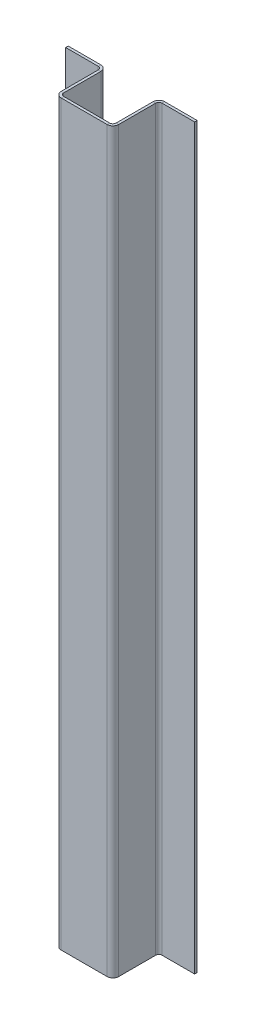
from build123d import *

# Parameters (mm, degrees)
SKETCH1_W                      = 45
SKETCH1_H                      = 578
BASE_FLANGE1_DEPTH             = 2
EDGE_FLANGE1_STRIP_W           = 13
EDGE_FLANGE1_STRIP_H           = 2
EDGE_FLANGE1_STRIP_CUT_DEPTH   = 578
EDGE_FLANGE1_STRIP_2_W         = 13
EDGE_FLANGE1_STRIP_2_H         = 2
EDGE_FLANGE1_STRIP_CUT_2_DEPTH = 578
EDGE_FLANGE1_DEPTH             = 578
EDGE_FLANGE1_BEND_DEPTH        = 578
EDGE_FLANGE2_STRIP_W           = 13
EDGE_FLANGE2_STRIP_H           = 2
EDGE_FLANGE2_STRIP_CUT_DEPTH   = 578
EDGE_FLANGE2_STRIP_2_W         = 13
EDGE_FLANGE2_STRIP_2_H         = 2
EDGE_FLANGE2_STRIP_CUT_2_DEPTH = 578
EDGE_FLANGE2_DEPTH             = 578
EDGE_FLANGE2_BEND_DEPTH        = 578


# Sheet-metal steps are written as plain solids
with BuildPart() as part:
    # Sketch1 → Base-Flange1 (new body)
    with BuildSketch(Plane.XY):
        Rectangle(SKETCH1_W, SKETCH1_H)
    extrude(amount=-BASE_FLANGE1_DEPTH)

    # Edge-Flange1 strip (across the edge) → Edge-Flange1 strip cut (cut)
    with BuildSketch(Plane(origin=(22.5, 289, -2), x_dir=(-1, 0, 0), z_dir=(0, -1, 0))):
        with Locations((-2, -1)):
            Rectangle(EDGE_FLANGE1_STRIP_W, EDGE_FLANGE1_STRIP_H)
    extrude(amount=EDGE_FLANGE1_STRIP_CUT_DEPTH, mode=Mode.SUBTRACT)

    # Edge-Flange1 strip 2 (across the edge) → Edge-Flange1 strip cut 2 (cut)
    with BuildSketch(Plane(origin=(-22.5, -289, -2), x_dir=(1, 0, 0), z_dir=(0, 1, 0))):
        with Locations((-2, -1)):
            Rectangle(EDGE_FLANGE1_STRIP_2_W, EDGE_FLANGE1_STRIP_2_H)
    extrude(amount=EDGE_FLANGE1_STRIP_CUT_2_DEPTH, mode=Mode.SUBTRACT)

    # Edge-Flange1 section (across the edge) → Edge-Flange1 (add)
    with BuildSketch(Plane(origin=(22.5, 289, -2), x_dir=(-1, 0, 0), z_dir=(0, -1, 0))):
        with BuildLine():
            Line((0, 2.5), (0, 36))
            Line((0, 36), (2, 36))
            Line((2, 36), (2, 2.5))
            ThreePointArc((2, 2.5), (2.732233047, 0.732233047), (4.5, 0))
            Line((4.5, 0), (4.5, -2))
            ThreePointArc((4.5, -2), (1.318019485, -0.681980515), (0, 2.5))
        make_face()
    extrude(amount=EDGE_FLANGE1_DEPTH)

    # Edge-Flange1 section 2 (across the edge) → Edge-Flange1 bend (add)
    with BuildSketch(Plane(origin=(-22.5, -289, -2), x_dir=(1, 0, 0), z_dir=(0, 1, 0))):
        with BuildLine():
            Line((0, 2.5), (0, 36))
            Line((0, 36), (2, 36))
            Line((2, 36), (2, 2.5))
            ThreePointArc((2, 2.5), (2.732233047, 0.732233047), (4.5, 0))
            Line((4.5, 0), (4.5, -2))
            ThreePointArc((4.5, -2), (1.318019485, -0.681980515), (0, 2.5))
        make_face()
    extrude(amount=EDGE_FLANGE1_BEND_DEPTH)

    # Edge-Flange2 strip (across the edge) → Edge-Flange2 strip cut (cut)
    with BuildSketch(Plane(origin=(-22.5, 289, -38), x_dir=(0, 0, 1), z_dir=(0, -1, 0))):
        with Locations((-2, -1)):
            Rectangle(EDGE_FLANGE2_STRIP_W, EDGE_FLANGE2_STRIP_H)
    extrude(amount=EDGE_FLANGE2_STRIP_CUT_DEPTH, mode=Mode.SUBTRACT)

    # Edge-Flange2 strip 2 (across the edge) → Edge-Flange2 strip cut 2 (cut)
    with BuildSketch(Plane(origin=(22.5, -289, -38), x_dir=(0, 0, 1), z_dir=(0, 1, 0))):
        with Locations((-2, -1)):
            Rectangle(EDGE_FLANGE2_STRIP_2_W, EDGE_FLANGE2_STRIP_2_H)
    extrude(amount=EDGE_FLANGE2_STRIP_CUT_2_DEPTH, mode=Mode.SUBTRACT)

    # Edge-Flange2 section (across the edge) → Edge-Flange2 (add)
    with BuildSketch(Plane(origin=(-22.5, 289, -38), x_dir=(0, 0, 1), z_dir=(0, -1, 0))):
        with BuildLine():
            Line((0, 2.5), (0, 28))
            Line((0, 28), (2, 28))
            Line((2, 28), (2, 2.5))
            ThreePointArc((2, 2.5), (2.732233047, 0.732233047), (4.5, 0))
            Line((4.5, 0), (4.5, -2))
            ThreePointArc((4.5, -2), (1.318019485, -0.681980515), (0, 2.5))
        make_face()
    extrude(amount=EDGE_FLANGE2_DEPTH)

    # Edge-Flange2 section 2 (across the edge) → Edge-Flange2 bend (add)
    with BuildSketch(Plane(origin=(22.5, -289, -38), x_dir=(0, 0, 1), z_dir=(0, 1, 0))):
        with BuildLine():
            Line((0, 2.5), (0, 28))
            Line((0, 28), (2, 28))
            Line((2, 28), (2, 2.5))
            ThreePointArc((2, 2.5), (2.732233047, 0.732233047), (4.5, 0))
            Line((4.5, 0), (4.5, -2))
            ThreePointArc((4.5, -2), (1.318019485, -0.681980515), (0, 2.5))
        make_face()
    extrude(amount=EDGE_FLANGE2_BEND_DEPTH)


solid = part.part
